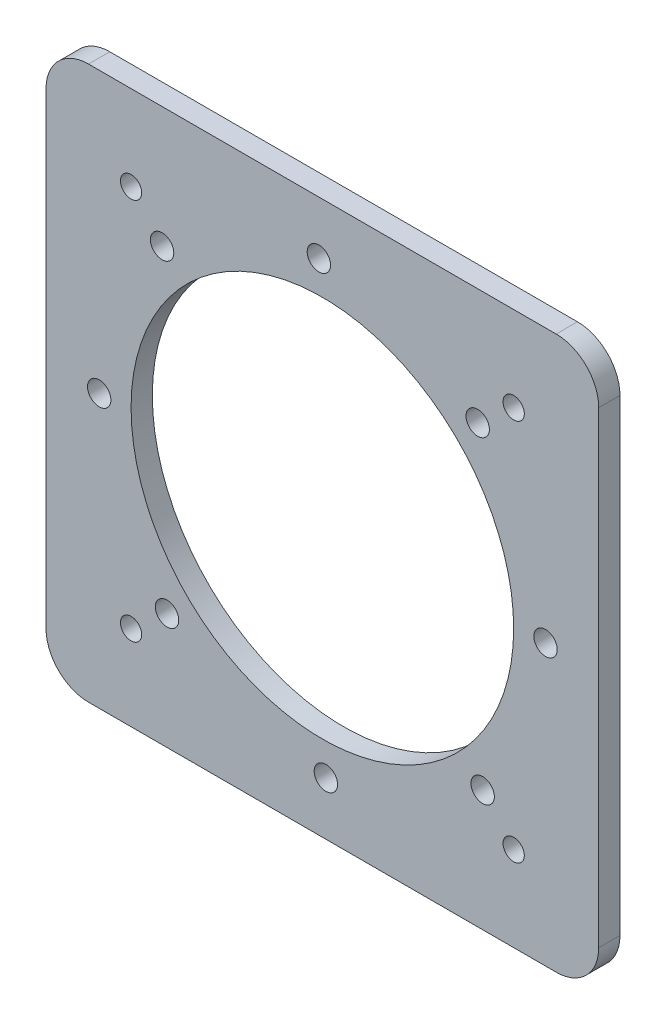
from build123d import *

# Parameters (mm, degrees)
SKETCH_1_W          = 130
SKETCH_1_H          = 130
EXTRUDE_1_DEPTH     = 5
CUT_EXTRUDE_2_REACH = 94.06
SKETCH_5_R          = 45
FILLET_1_R          = 10
CUT_EXTRUDE_3_DEPTH = 10
SKETCH_7_R          = 2.5
CUT_EXTRUDE_4_DEPTH = 93.059763198


with BuildPart() as part:
    # 草图1 → 凸台-拉伸1 (new body)
    with BuildSketch(Plane.XY):
        Rectangle(SKETCH_1_W, SKETCH_1_H)
    extrude(amount=EXTRUDE_1_DEPTH)

    # 草图5 → 切除-拉伸2 (cut, up to next)
    with BuildSketch(Plane(origin=(0, 0, 0), x_dir=(-1, 0, 0), z_dir=(0, 0, -1)), mode=Mode.PRIVATE) as cut_extrude_2_sk1:
        Circle(SKETCH_5_R)
    cut_extrude_2_tool1 = extrude(cut_extrude_2_sk1.sketch, amount=-CUT_EXTRUDE_2_REACH, mode=Mode.PRIVATE) & part.part
    add(cut_extrude_2_tool1.solids().sort_by_distance((0, 0, 0))[0], mode=Mode.SUBTRACT)

    # 圆角1
    fillet_1_edges = [part.edges().sort_by_distance(p)[0] for p in [
        (65, 65, 2.5),
        (65, -65, 2.5),
        (-65, -65, 2.5),
        (-65, 65, 2.5),
    ]]
    fillet(fillet_1_edges, radius=FILLET_1_R)

    # 草图6 → 切除-拉伸3 (cut)
    with BuildSketch(Plane(origin=(0, 0, 0), x_dir=(-1, 0, 0), z_dir=(0, 0, -1))):
        with BuildLine():
            ThreePointArc((39.675797976, 38.449883679), (35.787189387, 38.510902038), (35.726171029, 34.622293449))
            ThreePointArc((35.726171029, 34.622293449), (39.614779618, 34.56127509), (39.675797976, 38.449883679))
        make_face()
        with BuildLine():
            ThreePointArc((54.468351255, 1.090089298), (50.579742665, 1.151107656), (50.518724307, -2.737500933))
            ThreePointArc((50.518724307, -2.737500933), (54.407332896, -2.798519291), (54.468351255, 1.090089298))
        make_face()
        with BuildLine():
            ThreePointArc((38.510902038, -35.787189387), (34.622293449, -35.726171029), (34.56127509, -39.614779618))
            ThreePointArc((34.56127509, -39.614779618), (38.449883679, -39.675797976), (38.510902038, -35.787189387))
        make_face()
        with BuildLine():
            ThreePointArc((1.151107656, -50.579742665), (-2.737500933, -50.518724307), (-2.798519291, -54.407332896))
            ThreePointArc((-2.798519291, -54.407332896), (1.090089298, -54.468351255), (1.151107656, -50.579742665))
        make_face()
        with BuildLine():
            ThreePointArc((-35.726171029, -34.622293449), (-39.614779618, -34.56127509), (-39.675797976, -38.449883679))
            ThreePointArc((-39.675797976, -38.449883679), (-35.787189387, -38.510902038), (-35.726171029, -34.622293449))
        make_face()
        with BuildLine():
            ThreePointArc((-50.518724307, 2.737500933), (-54.407332896, 2.798519291), (-54.468351255, -1.090089298))
            ThreePointArc((-54.468351255, -1.090089298), (-50.579742665, -1.151107656), (-50.518724307, 2.737500933))
        make_face()
        with BuildLine():
            ThreePointArc((-34.56127509, 39.614779618), (-38.449883679, 39.675797976), (-38.510902038, 35.787189387))
            ThreePointArc((-38.510902038, 35.787189387), (-34.622293449, 35.726171029), (-34.56127509, 39.614779618))
        make_face()
        with BuildLine():
            ThreePointArc((2.798519291, 54.407332896), (-1.090089298, 54.468351255), (-1.151107656, 50.579742665))
            ThreePointArc((-1.151107656, 50.579742665), (2.737500933, 50.518724307), (2.798519291, 54.407332896))
        make_face()
    extrude(amount=-CUT_EXTRUDE_3_DEPTH, mode=Mode.SUBTRACT)

    # 草图7 → 切除-拉伸4 (cut, through all)
    with BuildSketch(Plane.XY.offset(5)):
        with Locations((-45, 45)):
            Circle(SKETCH_7_R)
        with Locations((45, 45)):
            Circle(SKETCH_7_R)
        with Locations((45, -45)):
            Circle(SKETCH_7_R)
        with Locations((-45, -45)):
            Circle(SKETCH_7_R)
    extrude(amount=-CUT_EXTRUDE_4_DEPTH, mode=Mode.SUBTRACT)


solid = part.part
